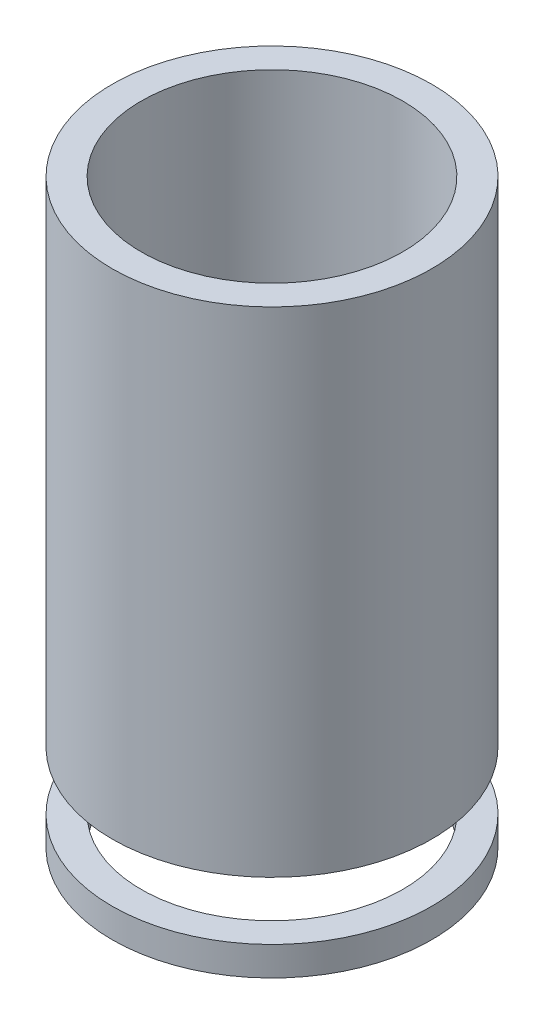
from build123d import *

# Parameters (mm, degrees)
SKETCH_1_W            = 10
SKETCH_1_H            = 200
THICKEN_START         = -90
THICKEN_1_OUTLINE_R   = 55
THICKEN_1_OUTLINE_R_2 = 45
THICKEN_1_DEPTH       = 20


# Read off the part's stored shape, not the designer's step: Вырез-Придать толщину1
with BuildPart() as part:
    # Эскиз1 → Повернуть1 (revolve)
    with BuildSketch(Plane.XY, mode=Mode.PRIVATE) as revolve_1_sk:
        with Locations((50, 0)):
            Rectangle(SKETCH_1_W, SKETCH_1_H)
    revolve(revolve_1_sk.sketch.rotate(Axis((0, -110.603092707, 0), (0, 1, 0)), 90), axis=Axis((0, -110.603092707, 0), (0, 1, 0)))

    # Вырез-Придать толщину1 outline → Вырез-Придать толщину1 (cut)
    with BuildSketch(Plane(origin=(0, 0, 0), x_dir=(1, 0, 0), z_dir=(0, 1, 0)).offset(THICKEN_START)):
        Circle(THICKEN_1_OUTLINE_R)
        Circle(THICKEN_1_OUTLINE_R_2, mode=Mode.SUBTRACT)
    extrude(amount=THICKEN_1_DEPTH, mode=Mode.SUBTRACT)


solid = part.part
